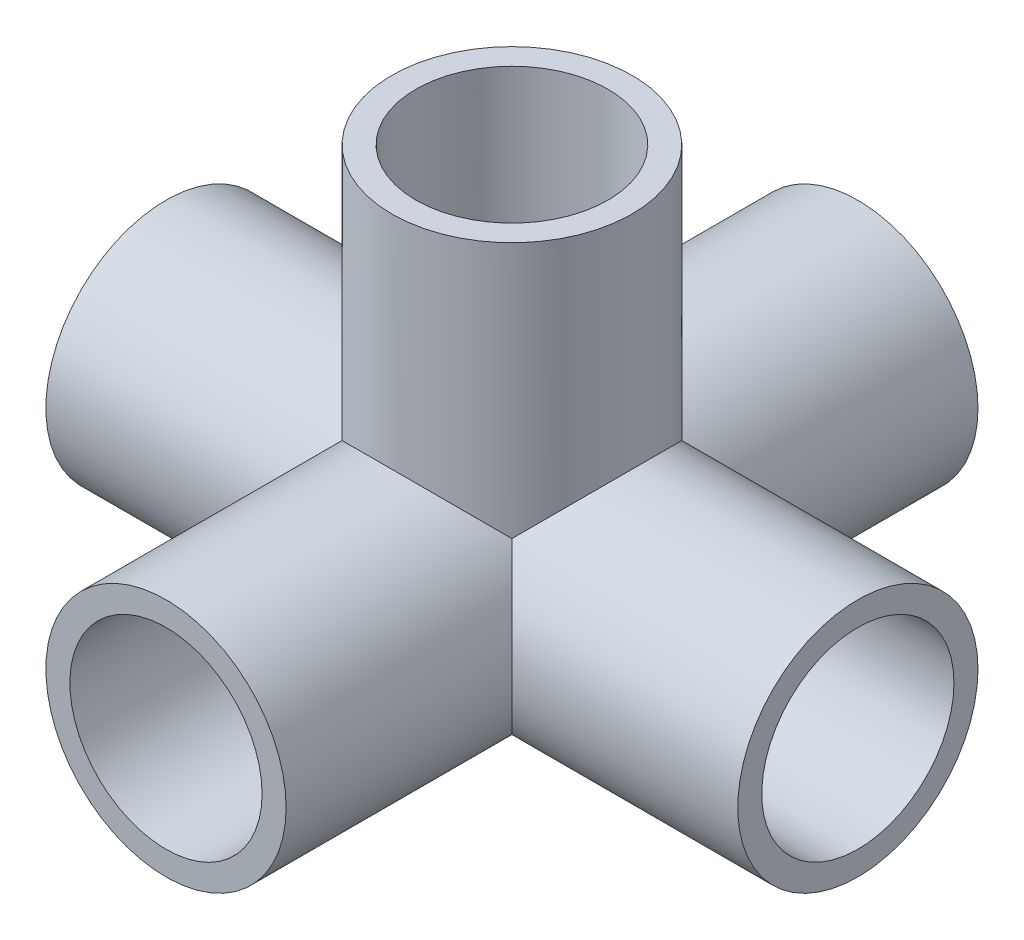
from build123d import *

# Parameters (mm, degrees)
SKETCH_1_R      = 10
EXTRUDE_1_DEPTH = 36
SKETCH_2_R      = 10
EXTRUDE_2_DEPTH = 35.5
SKETCH_3_R      = 10
EXTRUDE_3_DEPTH = 36
SHELL_1_T       = 2.5


with BuildPart() as part:
    # 草图1 → 凸台-拉伸1 (new, symmetric)
    with BuildSketch(Plane(origin=(0, 0, 0), x_dir=(0, 0, -1), z_dir=(1, 0, 0))):
        Circle(SKETCH_1_R)
    extrude(amount=EXTRUDE_1_DEPTH, both=True)

    # 草图2 → 凸台-拉伸2 (add)
    with BuildSketch(Plane(origin=(0, 0, 0), x_dir=(1, 0, 0), z_dir=(0, 1, 0))):
        Circle(SKETCH_2_R)
    extrude(amount=EXTRUDE_2_DEPTH)

    # 草图3 → 凸台-拉伸3 (add, symmetric)
    with BuildSketch(Plane.XY):
        Circle(SKETCH_3_R)
    extrude(amount=EXTRUDE_3_DEPTH, both=True)

    # 抽壳1
    shell_1_openings = [part.faces().sort_by_distance(p)[0] for p in [
        (-36, 0, 0),
        (36, 0, 0),
        (0, 0, 36),
        (0, 35.5, 0),
        (0, 0, -36),
    ]]
    offset(amount=SHELL_1_T, openings=shell_1_openings)


solid = part.part
